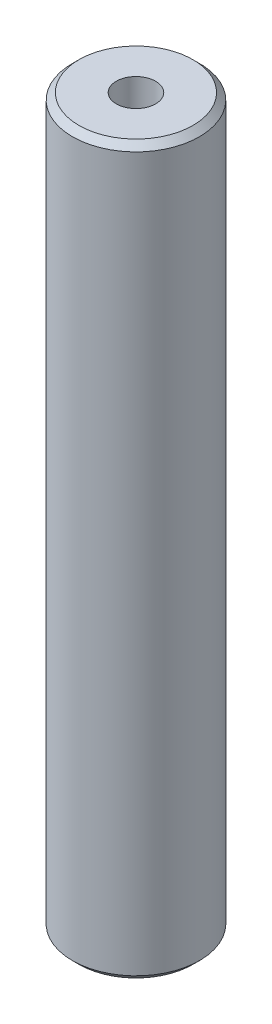
from build123d import *

# Parameters (mm, degrees)
SKETCH1_R           = 25
BOSS_EXTRUDE1_DEPTH = 285.929413298
SKETCH2_R           = 7.736721295
CUT_EXTRUDE1_DEPTH  = 289.106975599
CHAMFER1_SIZE       = 2.561043489


with BuildPart() as part:
    # Sketch1 → Boss-Extrude1 (new body)
    with BuildSketch(Plane(origin=(0, 0, 0), x_dir=(1, 0, 0), z_dir=(0, 1, 0))):
        Circle(SKETCH1_R)
    extrude(amount=BOSS_EXTRUDE1_DEPTH)

    # Sketch2 → Cut-Extrude1 (cut, through all)
    with BuildSketch(Plane(origin=(0, 0, 0), x_dir=(1, 0, 0), z_dir=(0, 1, 0))):
        Circle(SKETCH2_R)
    extrude(amount=CUT_EXTRUDE1_DEPTH, mode=Mode.SUBTRACT)

    # Chamfer1
    chamfer1_edges = [part.edges().sort_by_distance(p)[0] for p in [
        (-25, 285.929413298, 0),
        (-25, 0, 0),
    ]]
    chamfer(chamfer1_edges, length=CHAMFER1_SIZE)


solid = part.part
